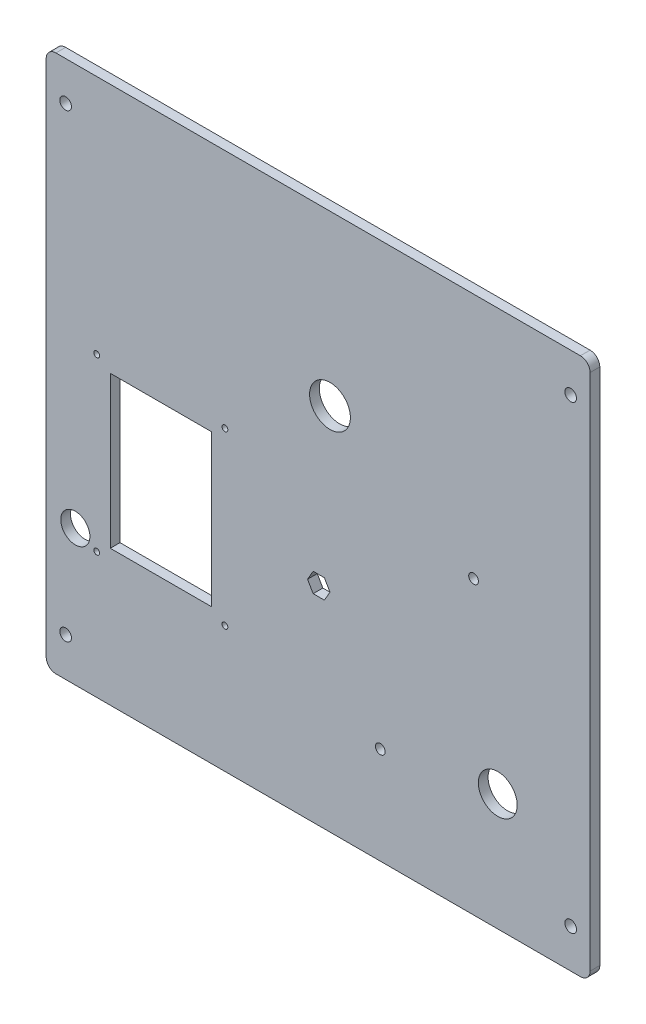
from build123d import *

# Parameters (mm, degrees)
ESQUISSE1_W             = 280
ESQUISSE1_H             = 276.83
BOSS_EXTRU_1_DEPTH      = 5
ESQUISSE2_R             = 3
ESQUISSE2_R_2           = 2.5
ESQUISSE2_R_3           = 1.5
ESQUISSE2_R_4           = 7.5
ESQUISSE2_R_5           = 10.5
ESQUISSE2_R_6           = 10
ESQUISSE2_W             = 52
ESQUISSE2_H             = 78
ENL_V_MAT_EXTRU_1_DEPTH = 394.776394544
CONG_1_R                = 5


with BuildPart() as part:
    # Esquisse1 → Boss.-Extru.1 (new body)
    with BuildSketch(Plane.XY):
        with Locations((140, 138.415)):
            Rectangle(ESQUISSE1_W, ESQUISSE1_H)
    extrude(amount=BOSS_EXTRU_1_DEPTH)

    # Esquisse2 → Enlèv. mat.-Extru.1 (cut, through all)
    with BuildSketch(Plane.XY):
        with Locations((270, 256.83)):
            Circle(ESQUISSE2_R)
        with Locations((10, 256.83)):
            Circle(ESQUISSE2_R)
        with Locations((10, 20)):
            Circle(ESQUISSE2_R)
        with Locations((270, 20)):
            Circle(ESQUISSE2_R)
        with Locations((220, 150)):
            Circle(ESQUISSE2_R_2)
        with Locations((172, 50)):
            Circle(ESQUISSE2_R_2)
        with Locations((92, 153)):
            Circle(ESQUISSE2_R_3)
        with Locations((26, 153)):
            Circle(ESQUISSE2_R_3)
        with Locations((92, 65)):
            Circle(ESQUISSE2_R_3)
        with Locations((26, 65)):
            Circle(ESQUISSE2_R_3)
        with Locations((15, 70)):
            Circle(ESQUISSE2_R_4)
        with Locations((146.093717203, 190)):
            Circle(ESQUISSE2_R_5)
        with Locations((232.477054828, 60.19739042)):
            Circle(ESQUISSE2_R_6)
        with Locations((59, 109)):
            Rectangle(ESQUISSE2_W, ESQUISSE2_H)
        Polygon((137.433463165, 111.971416316), (134.546711819, 106.971416316), (137.433463165, 101.971416316), (143.206965857, 101.971416316), (146.093717203, 106.971416316), (143.206965857, 111.971416316), align=None)
    extrude(amount=ENL_V_MAT_EXTRU_1_DEPTH, mode=Mode.SUBTRACT)

    # Congé1
    cong_1_edges = [part.edges().sort_by_distance(p)[0] for p in [
        (280, 276.83, 2.5),
        (280, 0, 2.5),
        (0, 0, 2.5),
        (0, 276.83, 2.5),
    ]]
    fillet(cong_1_edges, radius=CONG_1_R)


solid = part.part
